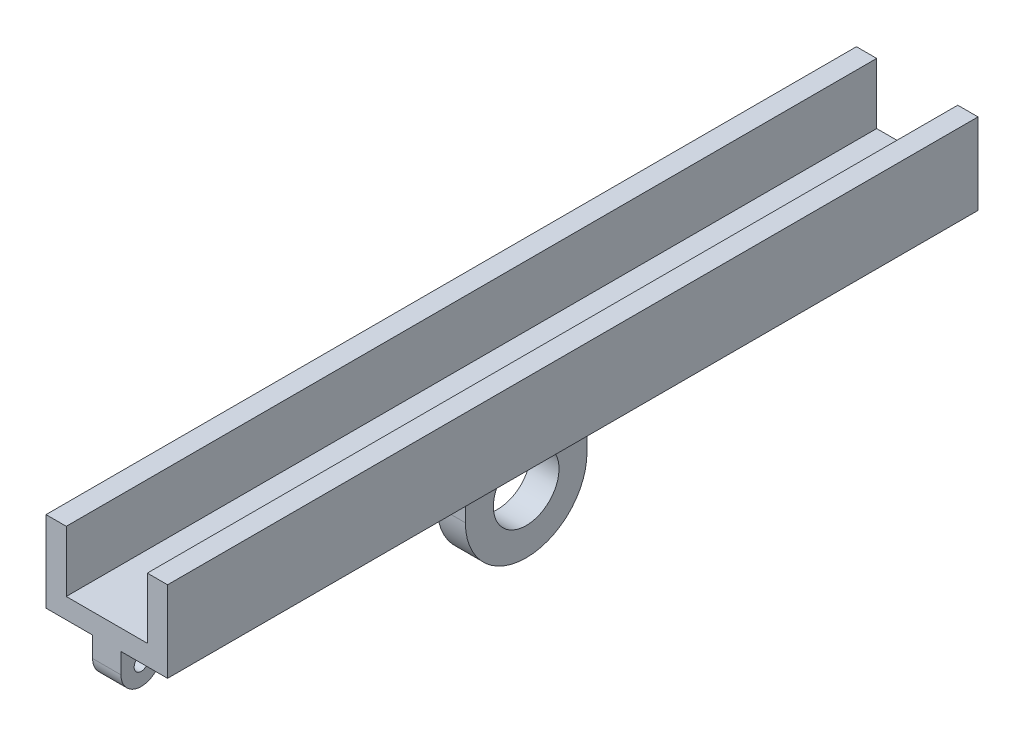
from build123d import *

# Parameters (mm, degrees)
BOSS_EXTRUDE1_DEPTH = 200
BOSS_EXTRUDE2_START = -11.5
SKETCH2_R           = 8.1
BOSS_EXTRUDE2_DEPTH = 7
BOSS_EXTRUDE3_START = -18.5
SKETCH3_W           = 10
SKETCH3_H           = 10
SKETCH3_R           = 1.75
BOSS_EXTRUDE3_DEPTH = 7
FILLET1_R           = 5
SKETCH5_R           = 1.5
CUT_EXTRUDE1_DEPTH  = 7


with BuildPart() as part:
    # Sketch1 → Boss-Extrude1 (new body)
    with BuildSketch(Plane.XY):
        Polygon((25, 20), (30, 20), (30, 0), (0, 0), (0, 20), (5, 20), (5, 5), (25, 5), align=None)
    extrude(amount=BOSS_EXTRUDE1_DEPTH)

    # Sketch2 → Boss-Extrude2 (add)
    with BuildSketch(Plane(origin=(30, 0, 0), x_dir=(0, 0, -1), z_dir=(1, 0, 0)).offset(BOSS_EXTRUDE2_START)):
        with BuildLine():
            Line((-115, -15), (-115, -10))
            ThreePointArc((-115, -10), (-117.928932188, -2.928932188), (-125, 0))
            Line((-125, 0), (-75, 0))
            ThreePointArc((-75, 0), (-82.071067812, -2.928932188), (-85, -10))
            Line((-85, -10), (-85, -15))
            ThreePointArc((-85, -15), (-100, -30), (-115, -15))
        make_face()
        with Locations(Location((-100, -15, 0), (0, 0, 90))):
            Circle(SKETCH2_R, mode=Mode.SUBTRACT)
    extrude(amount=-BOSS_EXTRUDE2_DEPTH)

    # Sketch3 → Boss-Extrude3 (add)
    with BuildSketch(Plane(origin=(30, 0, 0), x_dir=(0, 0, -1), z_dir=(1, 0, 0)).offset(BOSS_EXTRUDE3_START)):
        with Locations((-195, -5)):
            Rectangle(SKETCH3_W, SKETCH3_H)
        with Locations(Location((-195, -5, 0), (0, 0, 90))):
            Circle(SKETCH3_R, mode=Mode.SUBTRACT)
    extrude(amount=BOSS_EXTRUDE3_DEPTH)

    # Fillet1
    fillet1_edges = [part.edges().sort_by_distance(p)[0] for p in [
        (15, -10, 190),
        (15, -10, 200),
    ]]
    fillet(fillet1_edges, radius=FILLET1_R - 0.0001)  # a hair under: the kernel refuses the full size

    # Sketch5 → Cut-Extrude1 (cut)
    with BuildSketch(Plane(origin=(0, 5, 0), x_dir=(1, 0, 0), z_dir=(0, 1, 0))):
        with Locations(Location((15, -180, 0), (0, 0, 270))):
            Circle(SKETCH5_R)
        with Locations(Location((15, -160, 0), (0, 0, 270))):
            Circle(SKETCH5_R)
        with Locations(Location((15, -40, 0), (0, 0, 270))):
            Circle(SKETCH5_R)
        with Locations(Location((15, -20, 0), (0, 0, 270))):
            Circle(SKETCH5_R)
    extrude(amount=-CUT_EXTRUDE1_DEPTH, mode=Mode.SUBTRACT)


solid = part.part
